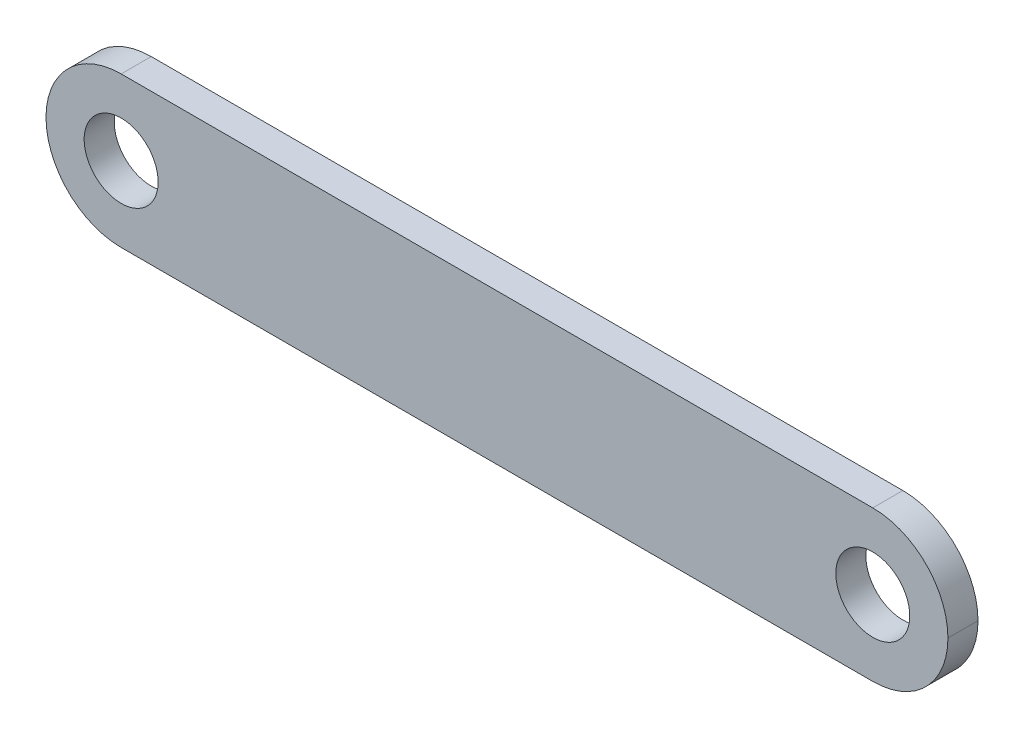
from build123d import *

# Parameters (mm, degrees)
SKETCH1_W                    = 152.4
SKETCH1_H                    = 25.4
BOSS_EXTRUDE1_DEPTH          = 5.08
F_12_5_12_5_DIAMETER_HOLE1_D = 12.5
FILLET3_R                    = 12.7


with BuildPart() as part:
    # Sketch1 → Boss-Extrude1 (new body)
    with BuildSketch(Plane.XY):
        Rectangle(SKETCH1_W, SKETCH1_H)
    extrude(amount=BOSS_EXTRUDE1_DEPTH)

    # Ø12.5 (12.5) Diameter Hole1 (through all)
    with Locations(Plane.XY.offset(5.08)):
        with Locations((-63.5, 0), (63.5, 0)):
            Hole(F_12_5_12_5_DIAMETER_HOLE1_D / 2)

    # Fillet3
    fillet3_edges = [part.edges().sort_by_distance(p)[0] for p in [
        (-76.2, 12.7, 2.54),
        (-76.2, -12.7, 2.54),
        (76.2, -12.7, 2.54),
        (76.2, 12.7, 2.54),
    ]]
    fillet(fillet3_edges, radius=FILLET3_R - 0.0001)  # a hair under: the kernel refuses the full size


solid = part.part
